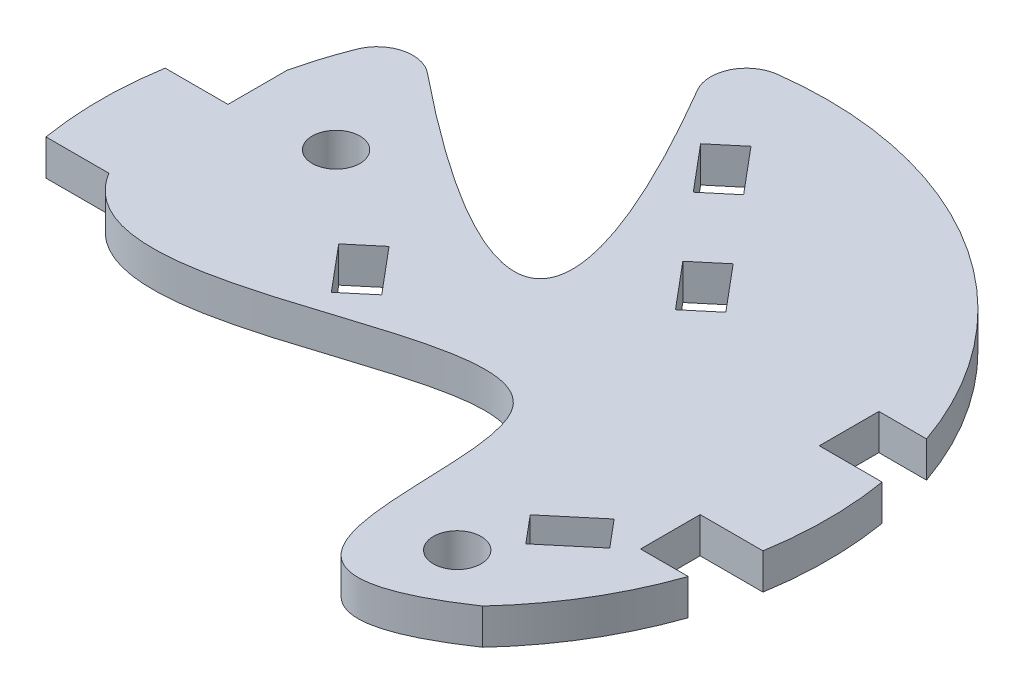
from build123d import *

# Parameters (mm, degrees)
CROQUIS1_R              = 30.5
SALIENTE_EXTRUIR1_DEPTH = 3
CORTAR_EXTRUIR3_START   = -4
CORTAR_EXTRUIR3_DEPTH   = 4
CORTAR_EXTRUIR6_START   = -10
CROQUIS9_R              = 2
CORTAR_EXTRUIR6_DEPTH   = 10
REDONDEO1_R             = 3


with BuildPart() as part:
    # Croquis1 → Saliente-Extruir1 (new body)
    with BuildSketch(Plane(origin=(0, 0, 0), x_dir=(1, 0, 0), z_dir=(0, 1, 0))):
        Circle(CROQUIS1_R)
    extrude(amount=SALIENTE_EXTRUIR1_DEPTH)

    # Croquis5 → Cortar-Extruir3 (cut)
    with BuildSketch(Plane(origin=(0, 3, 0), x_dir=(1, 0, 0), z_dir=(0, 1, 0)).offset(CORTAR_EXTRUIR3_START)):
        with BuildLine():
            Line((30.087372767, -5), (24.814059068, -5))
            Line((24.814059068, -5), (24.814059068, -10))
            Line((24.814059068, -10), (28.814059068, -10))
            ThreePointArc((28.814059068, -10), (29.556634924, -7.526973624), (30.087372767, -5))
        make_face()
        with BuildLine():
            Line((24.814059068, 5), (30.087372767, 5))
            ThreePointArc((30.087372767, 5), (29.556634924, 7.526973624), (28.814059068, 10))
            Line((28.814059068, 10), (24.814059068, 10))
            Line((24.814059068, 10), (24.814059068, 5))
        make_face()
        with BuildLine():
            ThreePointArc((-30.087372767, -5), (-29.556634924, -7.526973624), (-28.814059068, -10))
            Line((-28.814059068, -10), (-24.814059068, -10))
            Line((-24.814059068, -10), (-24.814059068, -5))
            Line((-24.814059068, -5), (-30.087372767, -5))
        make_face()
        with BuildLine():
            Line((-24.814059068, 10), (-28.814059068, 10))
            ThreePointArc((-28.814059068, 10), (-29.556634924, 7.526973624), (-30.087372767, 5))
            Line((-30.087372767, 5), (-24.814059068, 5))
            Line((-24.814059068, 5), (-24.814059068, 10))
        make_face()
    extrude(amount=CORTAR_EXTRUIR3_DEPTH, mode=Mode.SUBTRACT)

    # Croquis9 → Cortar-Extruir6 (cut)
    with BuildSketch(Plane(origin=(0, 3, 0), x_dir=(1, 0, 0), z_dir=(0, 1, 0)).offset(CORTAR_EXTRUIR6_START)):
        Polygon((5.673284852, 12.685390231), (8.887222901, 8.855168016), (11.18535623, 10.783530845), (7.971418181, 14.613753061), align=None)
        with BuildLine():
            add(Edge.make_bspline(
                [(22.328940845, -20.776631121), (5.973751648, -31.851207958), (22.176782581, 15.835204965), (-18.206868011, -15.807645224), (-24.814059068, -5)],
                knots=[0, 0, 0, 0, 0.445790092, 1, 1, 1, 1], degree=3))
            Line((-24.814059068, -5), (-24.814059068, -10))
            Line((-24.814059068, -10), (-28.814059068, -10))
            ThreePointArc((-28.814059068, -10), (-6.288730728, -29.84462876), (22.328940845, -20.776631121))
        make_face()
        with BuildLine():
            add(Edge.make_bspline(
                [(-18.745320889, 15.664553597), (3.867000935, -2.576496257), (8.094246487, 2.496379136), (-8.307345659, 29.346856869)],
                knots=[0.040527546, 0.040527546, 0.040527546, 0.040527546, 1, 1, 1, 1], degree=3))
            ThreePointArc((-8.307345659, 29.346856869), (-20.930238649, 22.185019948), (-28.814059068, 10))
            Line((-28.814059068, 10), (-24.814059068, 10))
            add(Edge.make_bspline(
                [(-24.814059068, 10), (-24.456478323, 11.504954743), (-23.99064654, 12.985671633), (-23.418905183, 14.432273611)],
                knots=[0.635079884, 0.635079884, 0.635079884, 0.635079884, 0.831813486, 0.831813486, 0.831813486, 0.831813486], degree=3))
            ThreePointArc((-23.418905183, 14.432273611), (-21.393777069, 16.230440533), (-18.745320889, 15.664553597))
        make_face()
        Polygon((-2.120514915, 21.973679104), (1.093423133, 18.143456889), (3.391556462, 20.071819718), (0.177618414, 23.902041933), align=None)
        Polygon((-4.518554854, -2.393615154), (-7.732492903, 1.436607062), (-10.030626232, -0.491755767), (-6.816688183, -4.321977983), align=None)
        Polygon((23.455638465, -11.229310268), (21.527275636, -8.931176939), (17.69705342, -12.145114987), (19.625416249, -14.443248317), align=None)
        with Locations((-16.983501418, 6.238634388)):
            Circle(CROQUIS9_R)
        with Locations((17.204026086, -17.780443199)):
            Circle(CROQUIS9_R)
    extrude(amount=CORTAR_EXTRUIR6_DEPTH, mode=Mode.SUBTRACT)

    # Redondeo1
    redondeo1_edges = [part.edges().sort_by_distance(p)[0] for p in [
        (-8.307345659, 1.5, -29.346856869),
    ]]
    fillet(redondeo1_edges, radius=REDONDEO1_R)


solid = part.part
